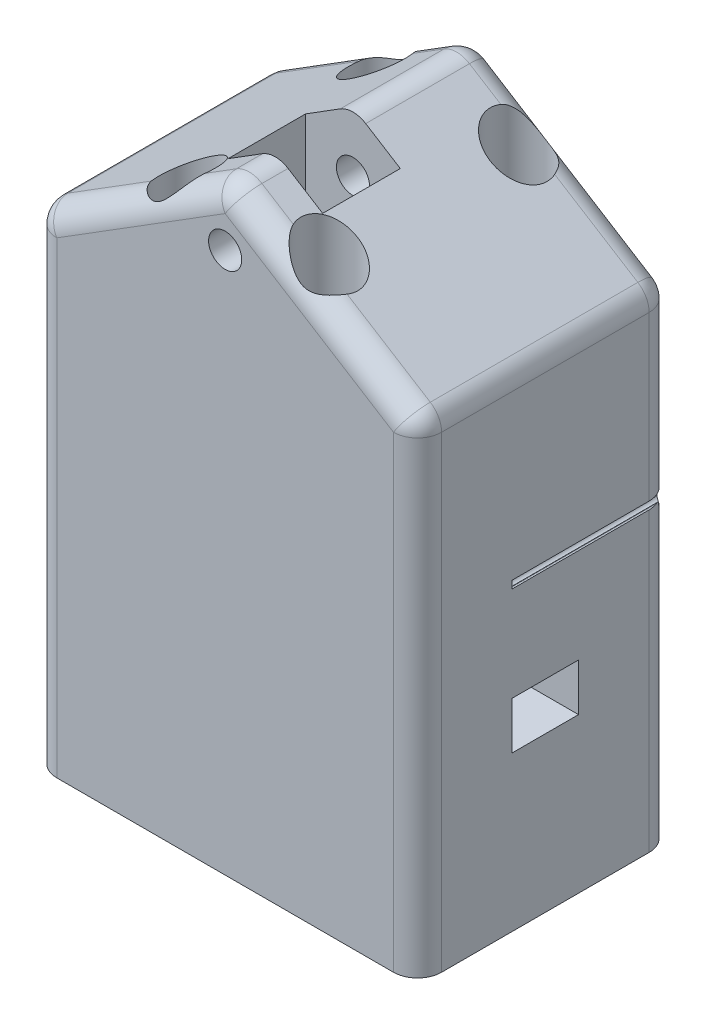
from build123d import *

# Parameters (mm, degrees)
SKETCH1_W            = 40.64
SKETCH1_H            = 27
SKETCH1_R            = 1.75
BOSS_EXTRUDE1_DEPTH  = 3.175
SKETCH3_W            = 40.64
SKETCH3_H            = 27
SKETCH3_R            = 3
BOSS_EXTRUDE2_DEPTH  = 44.45
SKETCH4_W            = 7
SKETCH4_H            = 3
CUT_EXTRUDE1_DEPTH   = 65.046859603
BOSS_EXTRUDE3_DEPTH  = 27
SKETCH6_R            = 3
CUT_EXTRUDE2_DEPTH   = 57.354169322
FILLET1_R            = 2.54
SKETCH8_W            = 10
SKETCH8_H            = 15
CUT_EXTRUDE3_DEPTH   = 8.2
SKETCH9_R            = 1.75
CUT_EXTRUDE4_DEPTH   = 69.747979603
CUT_EXTRUDE5_REACH   = 70.748
LPATTERN2_COUNT      = 4
LPATTERN2_PITCH      = 2
MIRROR5_COPY_1_REACH = 70.748
MIRROR5_COPY_2_REACH = 70.748
MIRROR5_COPY_3_REACH = 70.748
SKETCH12_W           = 7
SKETCH12_H           = 2
CUT_EXTRUDE7_DEPTH   = 74.608708078


with BuildPart() as part:
    # Sketch1 → Boss-Extrude1 (new, symmetric)
    with BuildSketch(Plane(origin=(0, 0, 0), x_dir=(1, 0, 0), z_dir=(0, 1, 0))):
        Rectangle(SKETCH1_W, SKETCH1_H)
        with Locations(Location((-7.499999986, 9.999999939, 0), (0, 0, 270))):
            Circle(SKETCH1_R, mode=Mode.SUBTRACT)
        with Locations(Location((7.499999986, 9.999999939, 0), (0, 0, 270))):
            Circle(SKETCH1_R, mode=Mode.SUBTRACT)
        with Locations(Location((7.499999986, -9.999999939, 0), (0, 0, 270))):
            Circle(SKETCH1_R, mode=Mode.SUBTRACT)
        with Locations(Location((-7.499999986, -9.999999939, 0), (0, 0, 270))):
            Circle(SKETCH1_R, mode=Mode.SUBTRACT)
    extrude(amount=BOSS_EXTRUDE1_DEPTH, both=True)

    # Sketch3 → Boss-Extrude2 (add)
    with BuildSketch(Plane(origin=(0, 3.175, 0), x_dir=(1, 0, 0), z_dir=(0, 1, 0))):
        Rectangle(SKETCH3_W, SKETCH3_H)
        with Locations(Location((-7.499999986, 9.999999939, 0), (0, 0, 270))):
            Circle(SKETCH3_R, mode=Mode.SUBTRACT)
        with Locations(Location((7.499999986, 9.999999939, 0), (0, 0, 270))):
            Circle(SKETCH3_R, mode=Mode.SUBTRACT)
        with Locations(Location((7.499999986, -9.999999939, 0), (0, 0, 270))):
            Circle(SKETCH3_R, mode=Mode.SUBTRACT)
        with Locations(Location((-7.499999986, -9.999999939, 0), (0, 0, 270))):
            Circle(SKETCH3_R, mode=Mode.SUBTRACT)
    extrude(amount=BOSS_EXTRUDE2_DEPTH)

    # Sketch4 → Cut-Extrude1 (cut, through all)
    with BuildSketch(Plane.ZY.offset(20.32)):
        with Locations((0, 14.6625)):
            Rectangle(SKETCH4_W, SKETCH4_H)
    extrude(amount=-CUT_EXTRUDE1_DEPTH, mode=Mode.SUBTRACT)

    # Sketch5 → Boss-Extrude3 (add, through all)
    with BuildSketch(Plane.XY.offset(13.5)):
        Polygon((-20.32, 47.625), (20.32, 47.625), (0, 60.325), align=None)
    extrude(amount=-BOSS_EXTRUDE3_DEPTH)

    # Sketch6 → Cut-Extrude2 (cut, through all)
    with BuildSketch(Plane.XZ.offset(-47.625)):
        with Locations(Location((-7.499999986, 9.999999939, 0), (0, 0, 180))):
            Circle(SKETCH6_R)
        with Locations((7.499999986, 9.999999939)):
            Circle(SKETCH6_R)
        with Locations((7.499999986, -9.999999939)):
            Circle(SKETCH6_R)
        with Locations(Location((-7.499999986, -9.999999939, 0), (0, 0, 180))):
            Circle(SKETCH6_R)
    extrude(amount=-CUT_EXTRUDE2_DEPTH, mode=Mode.SUBTRACT)

    # Fillet1
    # the kernel refuses this fillet: 2.54 mm, written as the material it takes off along each edge
    with BuildSketch(Plane(origin=(17.78, 46.217210991, -10.96), x_dir=(1, 0, 0), z_dir=(0, 0, -1))) as fillet1_piece_1_section:
        Polygon((0, 0), (FILLET1_R, 0), (FILLET1_R, -FILLET1_R * 0.554247641507), (FILLET1_R * 0.529998940003, -FILLET1_R * 0.847998304005), align=None)
    fillet1_piece_1 = extrude(amount=FILLET1_R, mode=Mode.PRIVATE)
    fillet1_piece_1 = fillet1_piece_1 - Plane(origin=(17.78, 46.217210991, -10.96), x_dir=(-0.8746424812468178, -0.48476853239294543, 0), z_dir=(0, 0, -1)) * Sphere(FILLET1_R, mode=Mode.PRIVATE)
    add(fillet1_piece_1, mode=Mode.SUBTRACT)
    with BuildSketch(Plane(origin=(-17.78, 46.217210991, -10.96), x_dir=(-0.5299989400031803, 0.8479983040050879, 0), z_dir=(0, 0, -1))) as fillet1_piece_2_section:
        Polygon((0, 0), (FILLET1_R, 0), (FILLET1_R, -FILLET1_R * 0.554247641507), (FILLET1_R * 0.529998940003, -FILLET1_R * 0.847998304005), align=None)
    fillet1_piece_2 = extrude(amount=FILLET1_R, mode=Mode.PRIVATE)
    fillet1_piece_2 = fillet1_piece_2 - Plane(origin=(-17.78, 46.217210991, -10.96), x_dir=(0.8746424812468178, -0.48476853239294515, 0), z_dir=(0, 0, -1)) * Sphere(FILLET1_R, mode=Mode.PRIVATE)
    add(fillet1_piece_2, mode=Mode.SUBTRACT)
    with BuildSketch(Plane(origin=(-17.78, 46.217210991, 10.96), x_dir=(-0.5299989400031803, 0.8479983040050879, 0), z_dir=(0, 0, 1))) as fillet1_piece_3_section:
        Polygon((0, 0), (FILLET1_R, 0), (FILLET1_R, FILLET1_R * 0.554247641507), (FILLET1_R * 0.529998940003, FILLET1_R * 0.847998304005), align=None)
    fillet1_piece_3 = extrude(amount=FILLET1_R, mode=Mode.PRIVATE)
    fillet1_piece_3 = fillet1_piece_3 - Plane(origin=(-17.78, 46.217210991, 10.96), x_dir=(0.8746424812468178, -0.48476853239294515, 0), z_dir=(0, 0, 1)) * Sphere(FILLET1_R, mode=Mode.PRIVATE)
    add(fillet1_piece_3, mode=Mode.SUBTRACT)
    with BuildSketch(Plane(origin=(17.78, 46.217210991, 10.96), x_dir=(1, 0, 0), z_dir=(0, 0, 1))) as fillet1_piece_4_section:
        Polygon((0, 0), (FILLET1_R, 0), (FILLET1_R, FILLET1_R * 0.554247641507), (FILLET1_R * 0.529998940003, FILLET1_R * 0.847998304005), align=None)
    fillet1_piece_4 = extrude(amount=FILLET1_R, mode=Mode.PRIVATE)
    fillet1_piece_4 = fillet1_piece_4 - Plane(origin=(17.78, 46.217210991, 10.96), x_dir=(-0.8746424812468178, -0.48476853239294543, 0), z_dir=(0, 0, 1)) * Sphere(FILLET1_R, mode=Mode.PRIVATE)
    add(fillet1_piece_4, mode=Mode.SUBTRACT)
    with BuildSketch(Plane(origin=(0, 57.329710991, -10.96), x_dir=(0.5299989400031798, 0.8479983040050881, 0), z_dir=(0, 0, -1))) as fillet1_piece_5_section:
        Polygon((0, 0), (FILLET1_R, 0), (FILLET1_R, -FILLET1_R * 0.625), (FILLET1_R * 0.438202247191, -FILLET1_R * 0.898876404494), align=None)
    fillet1_piece_5 = extrude(amount=FILLET1_R, mode=Mode.PRIVATE)
    fillet1_piece_5 = fillet1_piece_5 - Plane(origin=(0, 57.329710991, -10.96), x_dir=(0, -1, 0), z_dir=(0, 0, -1)) * Sphere(FILLET1_R, mode=Mode.PRIVATE)
    add(fillet1_piece_5, mode=Mode.SUBTRACT)
    with BuildSketch(Plane(origin=(0, 57.329710991, 10.96), x_dir=(0.5299989400031798, 0.8479983040050881, 0), z_dir=(0, 0, 1))) as fillet1_piece_6_section:
        Polygon((0, 0), (FILLET1_R, 0), (FILLET1_R, FILLET1_R * 0.625), (FILLET1_R * 0.438202247191, FILLET1_R * 0.898876404494), align=None)
    fillet1_piece_6 = extrude(amount=FILLET1_R, mode=Mode.PRIVATE)
    fillet1_piece_6 = fillet1_piece_6 - Plane(origin=(0, 57.329710991, 10.96), x_dir=(0, -1, 0), z_dir=(0, 0, 1)) * Sphere(FILLET1_R, mode=Mode.PRIVATE)
    add(fillet1_piece_6, mode=Mode.SUBTRACT)
    with BuildSketch(Plane(origin=(20.32, -9.525, -13.5), x_dir=(0, 0, 1), z_dir=(0, 1, 0)), Plane(origin=(-20.32, 46.217210991, -13.5), x_dir=(0, 0, 1), z_dir=(0, -1, 0)), Plane(origin=(-20.32, 46.217210991, 13.5), x_dir=(1, 0, 0), z_dir=(0, -1, 0)), Plane(origin=(20.32, -9.525, 13.5), x_dir=(-1, 0, 0), z_dir=(0, 1, 0))) as fillet1_piece_7:
        with BuildLine():
            CenterArc((FILLET1_R, -FILLET1_R), FILLET1_R, 90, 90)
            Line((0, -FILLET1_R), (0, 0))
            Line((0, 0), (FILLET1_R, 0))
        make_face()
    extrude(amount=55.742210991, mode=Mode.SUBTRACT)
    with BuildSketch(Plane(origin=(19.126197308, 48.371126683, -13.5), x_dir=(0, 0, 1), z_dir=(-0.8479983040050881, 0.5299989400031798, 0)), Plane(origin=(-1.346197308, 59.483626683, -13.5), x_dir=(0, 0, 1), z_dir=(-0.8479983040050879, -0.5299989400031803, 0)), Plane(origin=(-1.346197308, 59.483626683, 13.5), x_dir=(0.5299989400031803, -0.8479983040050877, 0), z_dir=(-0.8479983040050879, -0.5299989400031803, 0)), Plane(origin=(19.126197308, 48.371126683, 13.5), x_dir=(-0.5299989400031798, -0.8479983040050881, 0), z_dir=(-0.8479983040050881, 0.5299989400031798, 0))) as fillet1_piece_8:
        with BuildLine():
            CenterArc((FILLET1_R, -FILLET1_R), FILLET1_R, 90, 90)
            Line((0, -FILLET1_R), (0, 0))
            Line((0, 0), (FILLET1_R, 0))
        make_face()
    extrude(amount=20.967023066, mode=Mode.SUBTRACT)
    with BuildSketch(Plane(origin=(20.32, 47.625, 10.96), x_dir=(0, -1, 0), z_dir=(0, 0, -1))) as fillet1_piece_9:
        with BuildLine():
            CenterArc((FILLET1_R * 0.554247641507, FILLET1_R), FILLET1_R, 212.005383208, 57.994616792)
            Line((-FILLET1_R * 0.293750662498, FILLET1_R * 0.470001059997), (0, 0))
            Line((0, 0), (FILLET1_R * 0.554247641507, 0))
        make_face()
    extrude(amount=21.92, mode=Mode.SUBTRACT)
    with BuildSketch(Plane(origin=(-20.32, 47.625, -10.96), x_dir=(0.8479983040050877, 0.5299989400031805, 0), z_dir=(0, 0, 1))) as fillet1_piece_10:
        with BuildLine():
            CenterArc((FILLET1_R * 0.554247641507, -FILLET1_R), FILLET1_R, 90, 57.994616792)
            Line((-FILLET1_R * 0.293750662498, -FILLET1_R * 0.470001059997), (0, 0))
            Line((0, 0), (FILLET1_R * 0.554247641507, 0))
        make_face()
    extrude(amount=21.92, mode=Mode.SUBTRACT)
    with BuildSketch(Plane(origin=(0, 60.325, 10.96), x_dir=(0.8479983040050874, -0.529998940003181, 0), z_dir=(0, 0, -1))) as fillet1_piece_11:
        with BuildLine():
            CenterArc((FILLET1_R * 0.625, FILLET1_R), FILLET1_R, 205.989233584, 64.010766416)
            Line((-FILLET1_R * 0.273876404494, FILLET1_R * 0.561797752809), (0, 0))
            Line((0, 0), (FILLET1_R * 0.625, 0))
        make_face()
    extrude(amount=21.92, mode=Mode.SUBTRACT)

    # Sketch8 → Cut-Extrude3 (cut)
    with BuildSketch(Plane.XY):
        with Locations((0, 52.369710991)):
            Rectangle(SKETCH8_W, SKETCH8_H)
    extrude(amount=CUT_EXTRUDE3_DEPTH, mode=Mode.SUBTRACT)

    # Sketch9 → Cut-Extrude4 (cut, through all)
    with BuildSketch(Plane.XY.offset(13.5)):
        with Locations((0, 53.975)):
            Circle(SKETCH9_R)
    extrude(amount=-CUT_EXTRUDE4_DEPTH, mode=Mode.SUBTRACT)

    # Cut-Extrude5: up to this face of the body (flat: up to its plane)
    cut_extrude5_end = Plane(part.part.faces().sort_by_distance((0, 14.6625, 3.5))[0])
    # Sketch10 → Cut-Extrude5 (cut, up to the picked face)
    with BuildSketch(Plane(origin=(0, 0, -13.5), x_dir=(-1, 0, 0), z_dir=(0, 0, -1)), mode=Mode.PRIVATE) as cut_extrude5_sk1:
        with BuildLine():
            Line((-20.32, 28.962499876), (-18.32, 28.962499876))
            Line((-18.32, 28.962499876), (-18.32, 28.162499876))
            Line((-18.32, 28.162499876), (-18.472562627, 28.162499876))
            ThreePointArc((-18.472562627, 28.162499876), (-18.643588941, 28.094845701), (-18.722050101, 27.928499876))
            ThreePointArc((-18.722050101, 27.928499876), (-18.753307527, 27.736559134), (-18.821123596, 27.554297629))
            ThreePointArc((-18.821123596, 27.554297629), (-19.32, 27.242499876), (-19.818876404, 27.554297629))
            ThreePointArc((-19.818876404, 27.554297629), (-19.886692473, 27.736559134), (-19.917949899, 27.928499876))
            ThreePointArc((-19.917949899, 27.928499876), (-19.996411059, 28.094845701), (-20.167437373, 28.162499876))
            Line((-20.167437373, 28.162499876), (-20.32, 28.162499876))
            Line((-20.32, 28.162499876), (-20.32, 28.962499876))
        make_face()
    cut_extrude5_tool1 = split(extrude(cut_extrude5_sk1.sketch, amount=-CUT_EXTRUDE5_REACH, mode=Mode.PRIVATE), bisect_by=cut_extrude5_end, keep=Keep.BOTH, mode=Mode.PRIVATE)
    cut_extrude5 = cut_extrude5_tool1.solids().sort_by(Axis((19.32, 28.267244, -13.5), (0, 0, 1)))[0]
    add(cut_extrude5, mode=Mode.SUBTRACT)

    # LPattern2: Cut-Extrude5 ×4
    with Locations(*[(-i * LPATTERN2_PITCH, 0, 0) for i in range(1, LPATTERN2_COUNT)]):
        add(cut_extrude5, mode=Mode.SUBTRACT)

    # Mirror5: Cut-Extrude5 across plane
    add(cut_extrude5.mirror(Plane(origin=(0, 0, 0), x_dir=(0, 0, 1), z_dir=(1, 0, 0))), mode=Mode.SUBTRACT)

    # Mirror5 copy 1: up to this face of the body (flat: up to its plane)
    mirror5_copy_1_end = Plane(part.part.faces().sort_by_distance((2, 14.6625, 3.5))[0])
    # Mirror5 copy 1 sketch → Mirror5 copy 1 (cut, up to the picked face)
    with BuildSketch(Plane(origin=(2, 0, -13.5), x_dir=(1, 0, 0), z_dir=(0, 0, -1)), mode=Mode.PRIVATE) as mirror5_copy_1_sk1:
        with BuildLine():
            Line((-20.32, -28.962499876), (-18.32, -28.962499876))
            Line((-18.32, -28.962499876), (-18.32, -28.162499876))
            Line((-18.32, -28.162499876), (-18.472562627, -28.162499876))
            ThreePointArc((-18.472562627, -28.162499876), (-18.643588941, -28.094845701), (-18.722050101, -27.928499876))
            ThreePointArc((-18.722050101, -27.928499876), (-18.753307527, -27.736559134), (-18.821123596, -27.554297629))
            ThreePointArc((-18.821123596, -27.554297629), (-19.32, -27.242499876), (-19.818876404, -27.554297629))
            ThreePointArc((-19.818876404, -27.554297629), (-19.886692473, -27.736559134), (-19.917949899, -27.928499876))
            ThreePointArc((-19.917949899, -27.928499876), (-19.996411059, -28.094845701), (-20.167437373, -28.162499876))
            Line((-20.167437373, -28.162499876), (-20.32, -28.162499876))
            Line((-20.32, -28.162499876), (-20.32, -28.962499876))
        make_face()
    mirror5_copy_1_tool1 = split(extrude(mirror5_copy_1_sk1.sketch, amount=-MIRROR5_COPY_1_REACH, mode=Mode.PRIVATE), bisect_by=mirror5_copy_1_end, keep=Keep.BOTH, mode=Mode.PRIVATE)
    add(mirror5_copy_1_tool1.solids().sort_by(Axis((-17.32, 28.267244, -13.5), (0, 0, 1)))[0], mode=Mode.SUBTRACT)

    # Mirror5 copy 2: up to this face of the body (flat: up to its plane)
    mirror5_copy_2_end = Plane(part.part.faces().sort_by_distance((4, 14.6625, 3.5))[0])
    # Mirror5 copy 2 sketch → Mirror5 copy 2 (cut, up to the picked face)
    with BuildSketch(Plane(origin=(4, 0, -13.5), x_dir=(1, 0, 0), z_dir=(0, 0, -1)), mode=Mode.PRIVATE) as mirror5_copy_2_sk1:
        with BuildLine():
            Line((-20.32, -28.962499876), (-18.32, -28.962499876))
            Line((-18.32, -28.962499876), (-18.32, -28.162499876))
            Line((-18.32, -28.162499876), (-18.472562627, -28.162499876))
            ThreePointArc((-18.472562627, -28.162499876), (-18.643588941, -28.094845701), (-18.722050101, -27.928499876))
            ThreePointArc((-18.722050101, -27.928499876), (-18.753307527, -27.736559134), (-18.821123596, -27.554297629))
            ThreePointArc((-18.821123596, -27.554297629), (-19.32, -27.242499876), (-19.818876404, -27.554297629))
            ThreePointArc((-19.818876404, -27.554297629), (-19.886692473, -27.736559134), (-19.917949899, -27.928499876))
            ThreePointArc((-19.917949899, -27.928499876), (-19.996411059, -28.094845701), (-20.167437373, -28.162499876))
            Line((-20.167437373, -28.162499876), (-20.32, -28.162499876))
            Line((-20.32, -28.162499876), (-20.32, -28.962499876))
        make_face()
    mirror5_copy_2_tool1 = split(extrude(mirror5_copy_2_sk1.sketch, amount=-MIRROR5_COPY_2_REACH, mode=Mode.PRIVATE), bisect_by=mirror5_copy_2_end, keep=Keep.BOTH, mode=Mode.PRIVATE)
    add(mirror5_copy_2_tool1.solids().sort_by(Axis((-15.32, 28.267244, -13.5), (0, 0, 1)))[0], mode=Mode.SUBTRACT)

    # Mirror5 copy 3: up to this face of the body (flat: up to its plane)
    mirror5_copy_3_end = Plane(part.part.faces().sort_by_distance((6, 14.6625, 3.5))[0])
    # Mirror5 copy 3 sketch → Mirror5 copy 3 (cut, up to the picked face)
    with BuildSketch(Plane(origin=(6, 0, -13.5), x_dir=(1, 0, 0), z_dir=(0, 0, -1)), mode=Mode.PRIVATE) as mirror5_copy_3_sk1:
        with BuildLine():
            Line((-20.32, -28.962499876), (-18.32, -28.962499876))
            Line((-18.32, -28.962499876), (-18.32, -28.162499876))
            Line((-18.32, -28.162499876), (-18.472562627, -28.162499876))
            ThreePointArc((-18.472562627, -28.162499876), (-18.643588941, -28.094845701), (-18.722050101, -27.928499876))
            ThreePointArc((-18.722050101, -27.928499876), (-18.753307527, -27.736559134), (-18.821123596, -27.554297629))
            ThreePointArc((-18.821123596, -27.554297629), (-19.32, -27.242499876), (-19.818876404, -27.554297629))
            ThreePointArc((-19.818876404, -27.554297629), (-19.886692473, -27.736559134), (-19.917949899, -27.928499876))
            ThreePointArc((-19.917949899, -27.928499876), (-19.996411059, -28.094845701), (-20.167437373, -28.162499876))
            Line((-20.167437373, -28.162499876), (-20.32, -28.162499876))
            Line((-20.32, -28.162499876), (-20.32, -28.962499876))
        make_face()
    mirror5_copy_3_tool1 = split(extrude(mirror5_copy_3_sk1.sketch, amount=-MIRROR5_COPY_3_REACH, mode=Mode.PRIVATE), bisect_by=mirror5_copy_3_end, keep=Keep.BOTH, mode=Mode.PRIVATE)
    add(mirror5_copy_3_tool1.solids().sort_by(Axis((-13.32, 28.267244, -13.5), (0, 0, 1)))[0], mode=Mode.SUBTRACT)

    # Sketch12 → Cut-Extrude7 (cut, through all)
    with BuildSketch(Plane(origin=(20.32, 0, 0), x_dir=(0, 0, -1), z_dir=(1, 0, 0))):
        with Locations((0, 17.1625)):
            Rectangle(SKETCH12_W, SKETCH12_H)
    extrude(amount=-CUT_EXTRUDE7_DEPTH, mode=Mode.SUBTRACT)


solid = part.part
